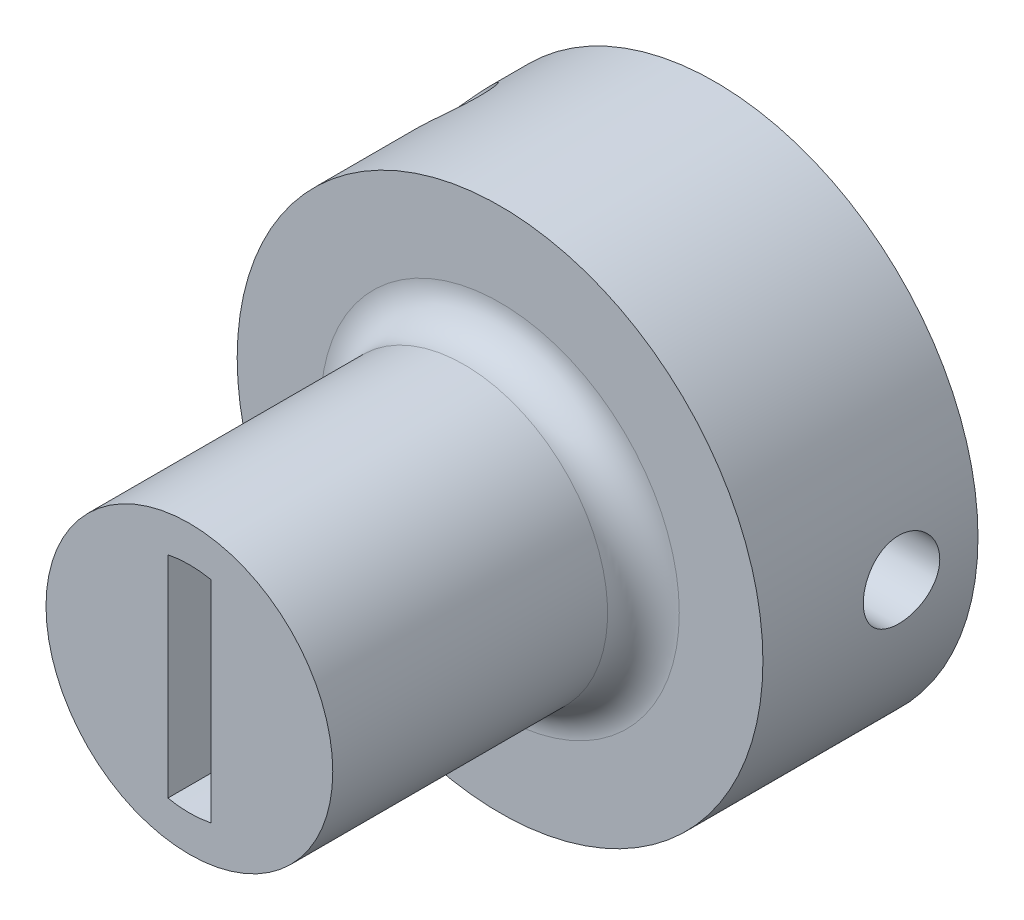
from build123d import *

# Parameters (mm, degrees)
SKETCH1_R           = 6
SKETCH1_R_2         = 2
BOSS_EXTRUDE1_DEPTH = 9
SKETCH2_R           = 6
BOSS_EXTRUDE2_DEPTH = 3
BOSS_EXTRUDE3_DEPTH = 10
SKETCH4_R           = 6
SKETCH4_R_2         = 4.5
BOSS_EXTRUDE4_DEPTH = 10
BOSS_EXTRUDE5_START = 9
SKETCH5_R           = 11
SKETCH5_R_2         = 6
BOSS_EXTRUDE5_DEPTH = 9
SKETCH6_W           = 2.7
SKETCH6_H           = 5.5
CUT_EXTRUDE1_DEPTH  = 6.2
SKETCH7_R           = 1.6
CUT_EXTRUDE2_DEPTH  = 29.809720582
SKETCH8_R           = 1.6
CUT_EXTRUDE3_DEPTH  = 30.43544272
FILLET1_R           = 0.9
FILLET2_R           = 1.5


with BuildPart() as part:
    # Sketch1 → Boss-Extrude1 (new body)
    with BuildSketch(Plane.XY):
        Circle(SKETCH1_R)
        Circle(SKETCH1_R_2, mode=Mode.SUBTRACT)
    extrude(amount=BOSS_EXTRUDE1_DEPTH)

    # Sketch2 → Boss-Extrude2 (add)
    with BuildSketch(Plane.XY.offset(9)):
        Circle(SKETCH2_R)
    extrude(amount=BOSS_EXTRUDE2_DEPTH)

    # Sketch3 → Boss-Extrude3 (add)
    with BuildSketch(Plane.XY.offset(12)):
        with BuildLine():
            Line((0.9, 4.409081537), (0.9, -4.409081537))
            ThreePointArc((0.9, -4.409081537), (4.5, 0), (0.9, 4.409081537))
        make_face()
        with BuildLine():
            Line((-0.9, 4.409081537), (-0.9, -4.409081537))
            ThreePointArc((-0.9, -4.409081537), (-4.5, 0), (-0.9, 4.409081537))
        make_face()
    extrude(amount=BOSS_EXTRUDE3_DEPTH)

    # Sketch4 → Boss-Extrude4 (add)
    with BuildSketch(Plane.XY.offset(12)):
        Circle(SKETCH4_R)
        Circle(SKETCH4_R_2, mode=Mode.SUBTRACT)
    extrude(amount=BOSS_EXTRUDE4_DEPTH)

    # Sketch5 → Boss-Extrude5 (add)
    with BuildSketch(Plane(origin=(0, 0, 9), x_dir=(-1, 0, 0), z_dir=(0, 0, -1)).offset(BOSS_EXTRUDE5_START)):
        with Locations(Location((0, 0, 0), (0, 0, 180))):
            Circle(SKETCH5_R)
        Circle(SKETCH5_R_2, mode=Mode.SUBTRACT)
    extrude(amount=-BOSS_EXTRUDE5_DEPTH)

    # Sketch6 → Cut-Extrude1 (cut)
    with BuildSketch(Plane(origin=(0, 0, 0), x_dir=(-1, 0, 0), z_dir=(0, 0, -1))):
        with Locations((-5.35, 0)):
            Rectangle(SKETCH6_W, SKETCH6_H)
        Polygon((2.855831889, 6.655578529), (6.708147842, 2.730064321), (4.781077231, 0.838927398), (0.928761278, 4.764441606), align=None)
    extrude(amount=-CUT_EXTRUDE1_DEPTH, mode=Mode.SUBTRACT)

    # Sketch7 → Cut-Extrude2 (cut, through all)
    with BuildSketch(Plane(origin=(4, 0, 0), x_dir=(0, 0, -1), z_dir=(1, 0, 0))):
        with Locations((-3.2, 0)):
            Circle(SKETCH7_R)
    extrude(amount=CUT_EXTRUDE2_DEPTH, mode=Mode.SUBTRACT)

    # Sketch8 → Cut-Extrude3 (cut, through all)
    with BuildSketch(Plane(origin=(-2.854919424, 2.80168433, 0), x_dir=(0, 0, 1), z_dir=(-0.7137298559492212, 0.7004210824402017, 0))):
        with Locations(Location((3.2, 0, 0), (0, 0, 90))):
            Circle(SKETCH8_R)
    extrude(amount=CUT_EXTRUDE3_DEPTH, mode=Mode.SUBTRACT)

    # Fillet1
    fillet1_edges = [part.edges().sort_by_distance(p)[0] for p in [
        (0.9, 0, 12),
        (-0.9, 0, 12),
        (0, 4.5, 12),
        (0, -4.5, 12),
    ]]
    fillet(fillet1_edges, radius=FILLET1_R - 0.0001)  # a hair under: the kernel refuses the full size

    # Fillet2
    fillet2_edges = [part.edges().sort_by_distance(p)[0] for p in [
        (-6, 0, 9),
    ]]
    fillet(fillet2_edges, radius=FILLET2_R)


solid = part.part
